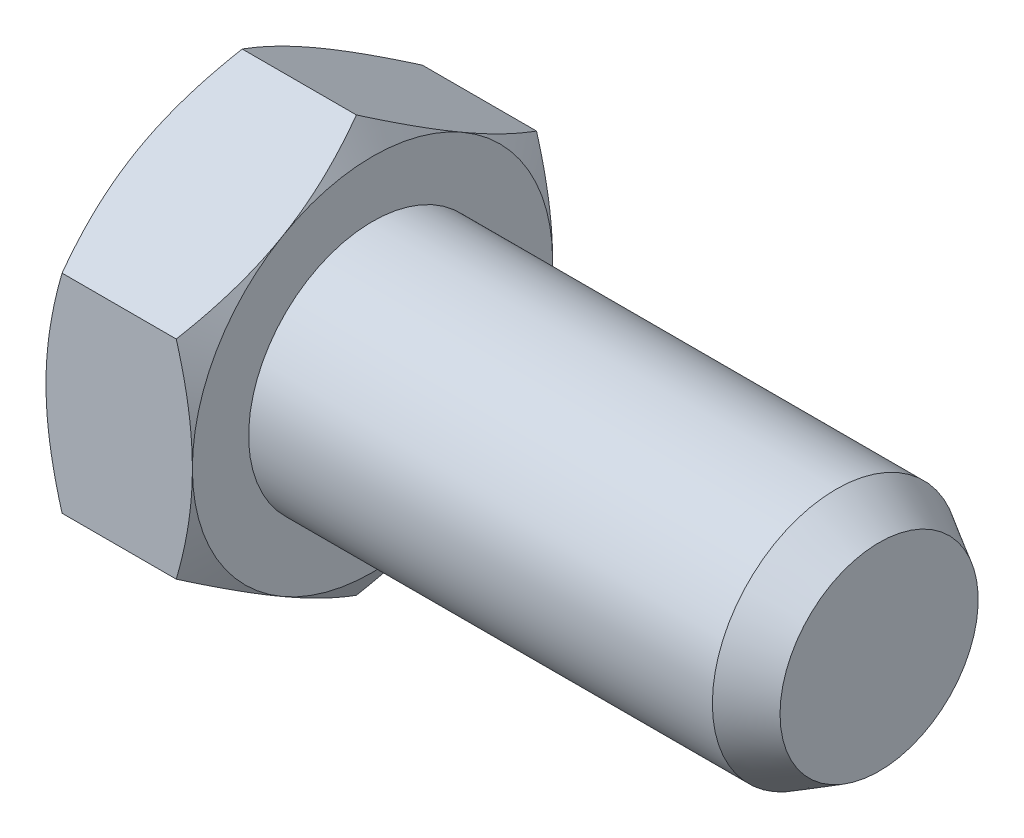
from build123d import *

# Parameters (mm, degrees)
EXTRUDE1_DEPTH = 1.3
SKETCH4_W      = 0.6
SKETCH4_H      = 1.28
CHAMFER1_SIZE  = 0.22
CHAMFER1_SIZE2 = 0.381051178


with BuildPart() as part:
    # Sketch1 → Revolve1 (revolve)
    with BuildSketch(Plane.XY):
        Polygon((0, 0), (0, 1.4), (1.3, 1.4), (1.3, 1.1), (5.8, 1.1), (5.8, 0), align=None)
    revolve(axis=Axis((13.107885839, 0, 0), (-1, 0, 0)))

    # Sketch2 → Extrude1 (add)
    with BuildSketch(Plane.ZY):
        Polygon((1.6, -0.923760431), (1.6, 0.923760431), (0, 1.847520861), (-1.6, 0.923760431), (-1.6, -0.923760431), (0, -1.847520861), align=None)
    extrude(amount=-EXTRUDE1_DEPTH)

    # Sketch3 → Cut-Revolve2 (revolve, cut)
    with BuildSketch(Plane(origin=(0, 0, 0), x_dir=(1, 0, 0), z_dir=(0, 1, 0))):
        Polygon((-0.923760431, 0), (0.65, 2.725833025), (1.3, 1.6), (1.3, 3.225833025), (-1.023760431, 3.225833025), (-1.023760431, 0), align=None)
    revolve(axis=Axis((0, 0, 0), (-1, 0, 0)), mode=Mode.SUBTRACT)

    # Sketch4 → Cut-Revolve3 (revolve, cut)
    with BuildSketch(Plane.XY):
        with Locations((0.1, 0.64)):
            Rectangle(SKETCH4_W, SKETCH4_H)
    revolve(axis=Axis((0, 0, 0), (1, 0, 0)), mode=Mode.SUBTRACT)

    # Chamfer1
    chamfer1_edges = [part.edges().sort_by_distance(p)[0] for p in [
        (5.8, -1.1, 0),
    ]]
    chamfer1_side = [part.faces().sort_by_distance(p)[0] for p in [
        (5.8, 0, 0),
    ]]
    chamfer(chamfer1_edges, length=CHAMFER1_SIZE, length2=CHAMFER1_SIZE2, reference=chamfer1_side[0])


solid = part.part
